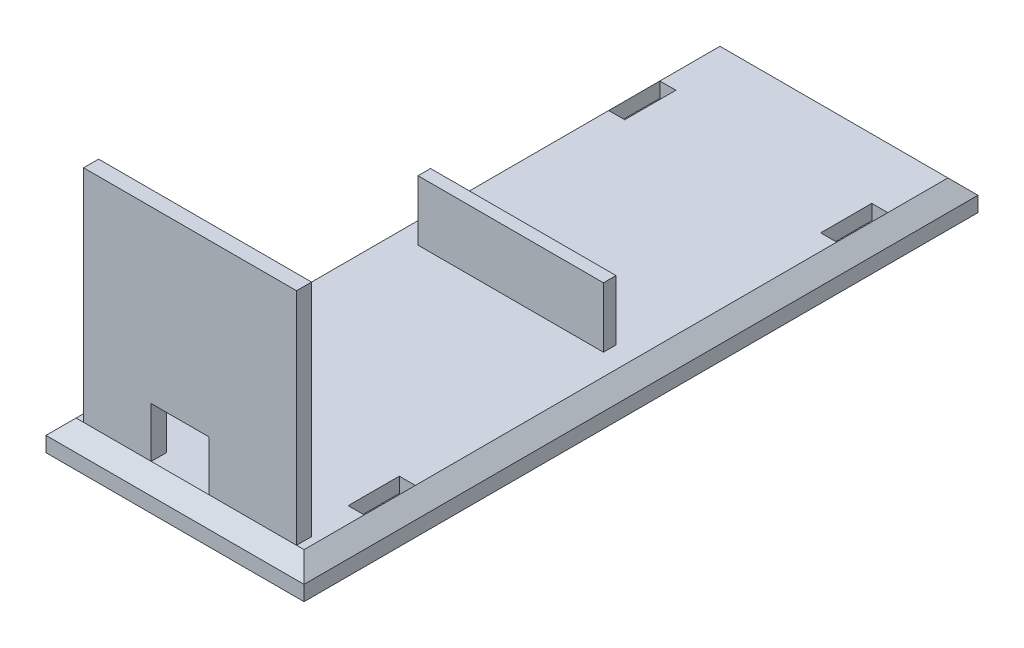
from build123d import *

# Parameters (mm, degrees)
LOFT1_OUTLINE_W     = 45.5
LOFT1_OUTLINE_H     = 128.5
LOFT1_DEPTH         = 3
LOFT1_DRAFT         = 45
LOFT2_START         = -6
LOFT2_OUTLINE_W     = 51.5
LOFT2_OUTLINE_H     = 134.5
LOFT2_DEPTH         = 3
SKETCH4_W           = 42.5
SKETCH4_H           = 3
BOSS_EXTRUDE1_DEPTH = 44
SKETCH5_W           = 11.5
SKETCH5_H           = 10
CUT_EXTRUDE1_DEPTH  = 45.5
SKETCH6_W           = 37.00940911
SKETCH6_H           = 2.5
BOSS_EXTRUDE2_DEPTH = 12
SKETCH7_W           = 3.2
SKETCH7_H           = 10.2
CUT_EXTRUDE2_DEPTH  = 3


# Read off the part's stored shape, not the designer's step: Loft1, Loft2
with BuildPart() as part:
    # Loft1 outline → Loft1 (with draft: the straight prism first)
    with BuildSketch(Plane(origin=(0, 0, 0), x_dir=(1, 0, 0), z_dir=(0, 1, 0))):
        Rectangle(LOFT1_OUTLINE_W, LOFT1_OUTLINE_H)
    extrude(amount=-LOFT1_DEPTH)
    # Loft1: the draft: its side faces are tilted about the plane it starts from
    loft1_sides = [part.faces().sort_by_distance(p)[0] for p in [
        (22.75, -1.5, 0),
        (0, -1.5, -64.25),
        (-22.75, -1.5, 0),
        (0, -1.5, 64.25),
    ]]
    draft(loft1_sides, Plane(origin=(0, 0, 0), x_dir=(1, 0, 0), z_dir=(0, 1, 0)), LOFT1_DRAFT)

    # Loft2 outline → Loft2 (add)
    with BuildSketch(Plane(origin=(0, 0, 0), x_dir=(1, 0, 0), z_dir=(0, 1, 0)).offset(LOFT2_START)):
        Rectangle(LOFT2_OUTLINE_W, LOFT2_OUTLINE_H)
    extrude(amount=LOFT2_DEPTH)

    # Sketch4 → Boss-Extrude1 (add)
    with BuildSketch(Plane(origin=(0, 0, 0), x_dir=(1, 0, 0), z_dir=(0, 1, 0))):
        with Locations((0, -62.75)):
            Rectangle(SKETCH4_W, SKETCH4_H)
    extrude(amount=BOSS_EXTRUDE1_DEPTH)

    # Sketch5 → Cut-Extrude1 (cut)
    with BuildSketch(Plane.XY.offset(64.25)):
        with Locations((-2, 5)):
            Rectangle(SKETCH5_W, SKETCH5_H)
    extrude(amount=-CUT_EXTRUDE1_DEPTH, mode=Mode.SUBTRACT)

    # Sketch6 → Boss-Extrude2 (add)
    with BuildSketch(Plane(origin=(0, 0, 0), x_dir=(1, 0, 0), z_dir=(0, 1, 0))):
        with Locations((0, 1)):
            Rectangle(SKETCH6_W, SKETCH6_H)
    extrude(amount=BOSS_EXTRUDE2_DEPTH)

    # Sketch7 → Cut-Extrude2 (cut)
    with BuildSketch(Plane(origin=(0, 0, 0), x_dir=(1, 0, 0), z_dir=(0, 1, 0))):
        with Locations((-21.15, 47.15)):
            Rectangle(SKETCH7_W, SKETCH7_H)
        with Locations((21.15, 47.15)):
            Rectangle(SKETCH7_W, SKETCH7_H)
        with Locations((-21.15, -47.15)):
            Rectangle(SKETCH7_W, SKETCH7_H)
        with Locations((21.15, -47.15)):
            Rectangle(SKETCH7_W, SKETCH7_H)
    extrude(amount=-CUT_EXTRUDE2_DEPTH, mode=Mode.SUBTRACT)


solid = part.part
